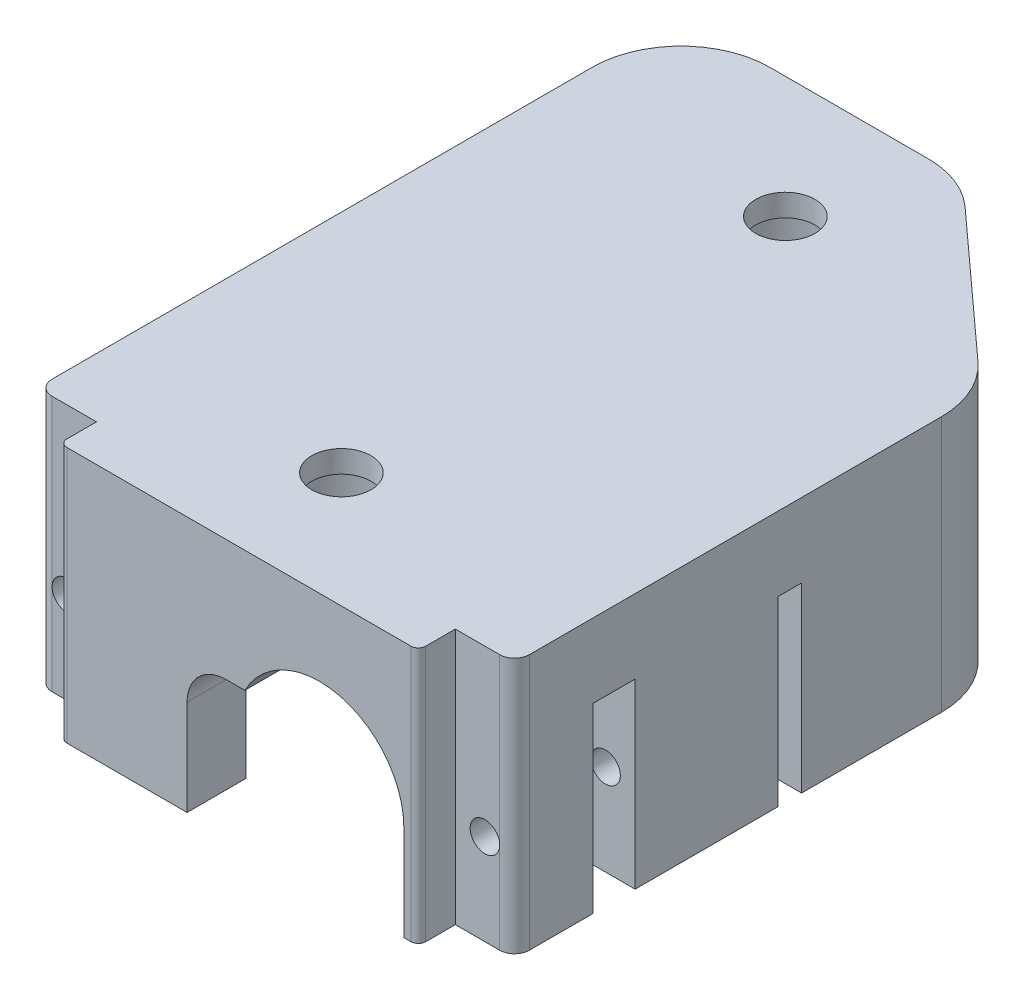
from build123d import *

# Parameters (mm, degrees)
ESQUISSE1_W              = 32.25
ESQUISSE1_H              = 12.3
BOSS_EXTRU_1_DEPTH       = 5
ESQUISSE2_W              = 4.7
ESQUISSE2_H              = 12.3
BOSS_EXTRU_2_DEPTH       = 16.25
ESQUISSE5_W              = 32.25
ESQUISSE5_H              = 5
BOSS_EXTRU_4_DEPTH       = 27.9
ESQUISSE6_W              = 4.7
ESQUISSE6_H              = 3.8
BOSS_EXTRU_5_DEPTH       = 12.3
ESQUISSE7_W              = 32.25
ESQUISSE7_H              = 17.3
BOSS_EXTRU_6_DEPTH       = 4
ENL_V_MAT_EXTRU_2_DEPTH  = 4.3
ENL_V_START              = -12.3
ESQUISSE9_W              = 4.7
ESQUISSE9_H              = 1.6
ENL_V_MAT_EXTRU_3_DEPTH  = 12.3
ESQUISSE10_R             = 1
ENL_V_MAT_EXTRU_4_DEPTH  = 20.3
ESQUISSE16_W             = 32.25
ESQUISSE16_H             = 17.3
BOSS_EXTRU_8_DEPTH       = 14.1
ENL_V_START_2            = -17.3
ESQUISSE18_R             = 2
ENL_V_MAT_EXTRU_8_DEPTH  = 17.3
CONG_4_R                 = 6
ESQUISSE19_R             = 3.8
ENL_V_MAT_EXTRU_9_DEPTH  = 15.8
ESQUISSE20_W             = 4
ESQUISSE20_H             = 17.3
ENL_V_MAT_EXTRU_10_DEPTH = 2.5
ENL_V_MAT_EXTRU_11_DEPTH = 17.3
CONG_5_R                 = 6
CONG_6_R                 = 6
CONG_7_R                 = 1
CONG_8_R                 = 1
CONG_9_R                 = 0.5
CONG_10_R                = 0.5
CONG_11_R                = 0.5


with BuildPart() as part:
    # Esquisse1 → Boss.-Extru.1 (new body)
    with BuildSketch(Plane.XY):
        with Locations((16.125, -6.15)):
            Rectangle(ESQUISSE1_W, ESQUISSE1_H)
    extrude(amount=BOSS_EXTRU_1_DEPTH)

    # Esquisse2 → Boss.-Extru.2 (add)
    with BuildSketch(Plane.XY.offset(5)):
        with Locations((2.35, -6.15)):
            Rectangle(ESQUISSE2_W, ESQUISSE2_H)
        with Locations((29.9, -6.15)):
            Rectangle(ESQUISSE2_W, ESQUISSE2_H)
    extrude(amount=BOSS_EXTRU_2_DEPTH)

    # Esquisse5 → Boss.-Extru.4 (add)
    with BuildSketch(Plane(origin=(0, 0, 0), x_dir=(-1, 0, 0), z_dir=(0, 0, -1))):
        with Locations((-16.125, 2.5)):
            Rectangle(ESQUISSE5_W, ESQUISSE5_H)
    extrude(amount=-BOSS_EXTRU_4_DEPTH)

    # Esquisse6 → Boss.-Extru.5 (add)
    with BuildSketch(Plane.XZ):
        with Locations((29.9, 26)):
            Rectangle(ESQUISSE6_W, ESQUISSE6_H)
        with Locations((2.35, 26)):
            Rectangle(ESQUISSE6_W, ESQUISSE6_H)
    extrude(amount=BOSS_EXTRU_5_DEPTH)

    # Esquisse7 → Boss.-Extru.6 (add)
    with BuildSketch(Plane.XY.offset(27.9)):
        with Locations((16.125, -3.65)):
            Rectangle(ESQUISSE7_W, ESQUISSE7_H)
    extrude(amount=BOSS_EXTRU_6_DEPTH)

    # Esquisse8 → Enlèv. mat.-Extru.2 (cut)
    with BuildSketch(Plane.XY.offset(31.9)):
        with BuildLine():
            Line((12.62, -5.85), (12.62, -12.3))
            Line((12.62, -12.3), (27.27, -12.3))
            Line((27.27, -12.3), (27.27, -5.85))
            ThreePointArc((27.27, -5.85), (22.934690305, -0.315777347), (16.523466536, -3.2))
            Line((16.523466536, -3.2), (15.27, -3.2))
            ThreePointArc((15.27, -3.2), (13.39616703, -3.97616703), (12.62, -5.85))
        make_face()
    extrude(amount=-ENL_V_MAT_EXTRU_2_DEPTH, mode=Mode.SUBTRACT)

    # Esquisse9 → Enlèv. mat.-Extru.3 (cut)
    with BuildSketch(Plane.XZ.offset(12.3).offset(ENL_V_START)):
        with Locations((29.9, 10.8)):
            Rectangle(ESQUISSE9_W, ESQUISSE9_H)
    extrude(amount=ENL_V_MAT_EXTRU_3_DEPTH, mode=Mode.SUBTRACT)

    # Esquisse10 → Enlèv. mat.-Extru.4 (cut)
    with BuildSketch(Plane.XY.offset(31.9)):
        with Locations((30.25, -6.15)):
            Circle(ESQUISSE10_R)
        with Locations((2, -6.15)):
            Circle(ESQUISSE10_R)
    extrude(amount=-ENL_V_MAT_EXTRU_4_DEPTH, mode=Mode.SUBTRACT)

    # Esquisse16 → Boss.-Extru.8 (add)
    with BuildSketch(Plane(origin=(0, 0, 0), x_dir=(-1, 0, 0), z_dir=(0, 0, -1))):
        with Locations((-16.125, -3.65)):
            Rectangle(ESQUISSE16_W, ESQUISSE16_H)
    extrude(amount=BOSS_EXTRU_8_DEPTH)

    # Esquisse18 → Enlèv. mat.-Extru.8 (cut)
    with BuildSketch(Plane(origin=(0, 5, 0), x_dir=(1, 0, 0), z_dir=(0, 1, 0)).offset(ENL_V_START_2)):
        with Locations(Location((15.25, -24.1, 0), (0, 0, 270))):
            Circle(ESQUISSE18_R)
        with Locations(Location((15.25, 5.9, 0), (0, 0, 270))):
            Circle(ESQUISSE18_R)
    extrude(amount=ENL_V_MAT_EXTRU_8_DEPTH, mode=Mode.SUBTRACT)

    # Congé4
    cong_4_edges = [part.edges().sort_by_distance(p)[0] for p in [
        (0, -3.65, -14.1),
    ]]
    fillet(cong_4_edges, radius=CONG_4_R)

    # Esquisse19 → Enlèv. mat.-Extru.9 (cut)
    with BuildSketch(Plane.XZ.offset(12.3)):
        with Locations(Location((15.25, -5.9, 0), (0, 0, 270))):
            Circle(ESQUISSE19_R)
        with Locations(Location((15.25, 24.1, 0), (0, 0, 270))):
            Circle(ESQUISSE19_R)
    extrude(amount=-ENL_V_MAT_EXTRU_9_DEPTH, mode=Mode.SUBTRACT)

    # Esquisse20 → Enlèv. mat.-Extru.10 (cut)
    with BuildSketch(Plane.XY.offset(31.9)):
        with Locations((2, -3.65)):
            Rectangle(ESQUISSE20_W, ESQUISSE20_H)
        with Locations((30.25, -3.65)):
            Rectangle(ESQUISSE20_W, ESQUISSE20_H)
    extrude(amount=-ENL_V_MAT_EXTRU_10_DEPTH, mode=Mode.SUBTRACT)

    # Esquisse22 → Enlèv. mat.-Extru.11 (cut)
    with BuildSketch(Plane.XZ.offset(12.3).offset(ENL_V_START_2)):
        Polygon((19.038139385, -14.1), (32.25, -2.1), (32.25, -14.1), align=None)
    extrude(amount=ENL_V_MAT_EXTRU_11_DEPTH, mode=Mode.SUBTRACT)

    # Congé5
    cong_5_edges = [part.edges().sort_by_distance(p)[0] for p in [
        (19.038139385, -3.65, -14.1),
    ]]
    fillet(cong_5_edges, radius=CONG_5_R)

    # Congé6
    cong_6_edges = [part.edges().sort_by_distance(p)[0] for p in [
        (32.25, -3.65, -2.1),
    ]]
    fillet(cong_6_edges, radius=CONG_6_R)

    # Congé7
    cong_7_edges = [part.edges().sort_by_distance(p)[0] for p in [
        (32.25, -3.65, 29.4),
    ]]
    fillet(cong_7_edges, radius=CONG_7_R - 0.0001)  # a hair under: the kernel refuses the full size

    # Congé8
    cong_8_edges = [part.edges().sort_by_distance(p)[0] for p in [
        (0, -3.65, 29.4),
    ]]
    fillet(cong_8_edges, radius=CONG_8_R - 0.0001)  # a hair under: the kernel refuses the full size

    # Congé9
    cong_9_edges = [part.edges().sort_by_distance(p)[0] for p in [
        (28.25, -3.65, 31.9),
    ]]
    fillet(cong_9_edges, radius=CONG_9_R)

    # Congé10
    cong_10_edges = [part.edges().sort_by_distance(p)[0] for p in [
        (4, -3.65, 31.9),
    ]]
    fillet(cong_10_edges, radius=CONG_10_R)

    # Congé11
    cong_11_edges = [part.edges().sort_by_distance(p)[0] for p in [
        (27.55, -6.15, 10),
        (27.55, -6.15, 11.6),
        (4.7, -6.15, 21.25),
        (27.55, -6.15, 21.25),
        (27.55, -6.15, 24.1),
        (4.7, -6.15, 24.1),
    ]]
    fillet(cong_11_edges, radius=CONG_11_R)


solid = part.part
